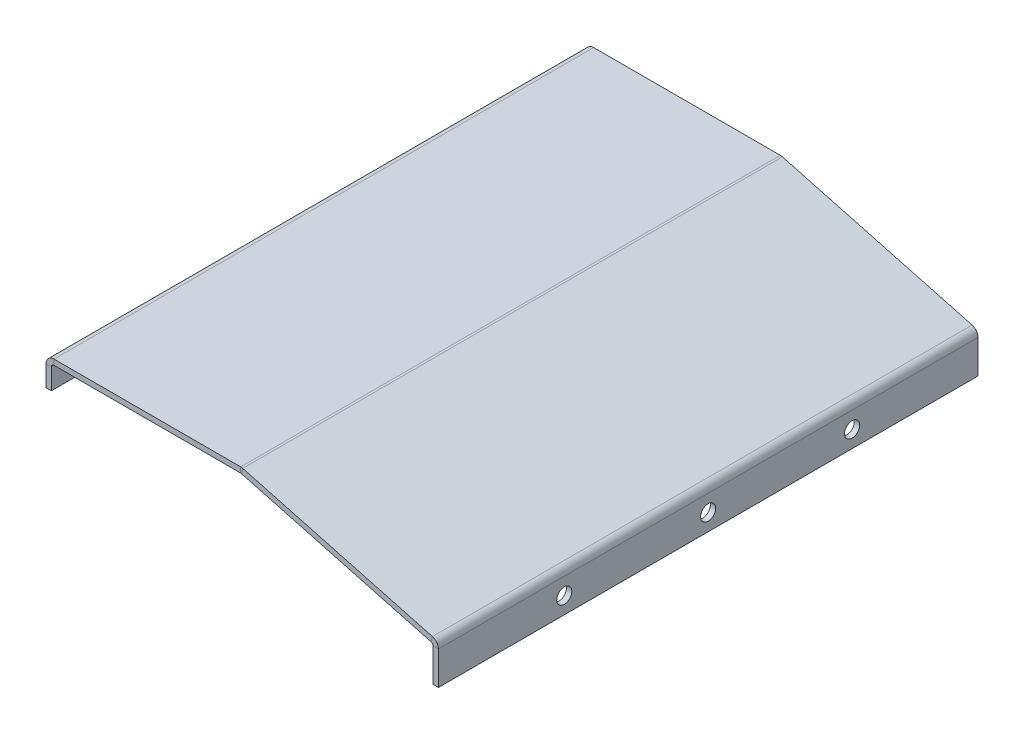
from build123d import *

# Parameters (mm, degrees)
SKETCH_1_W                       = 60
SKETCH_1_H                       = 1.5
SM_BASE_FLANGE_1_DEPTH           = 150
SM_EDGE_FLANGE_1_DEPTH           = 150
SM_EDGE_FLANGE_1_2_DEPTH         = 150
SM_EDGE_FLANGE_2_STRIP_W         = 7.4732
SM_EDGE_FLANGE_2_STRIP_H         = 1.5
SM_EDGE_FLANGE_2_STRIP_CUT_DEPTH = 150
SM_EDGE_FLANGE_2_DEPTH           = 150
SKETCH_12_R                      = 2.1
CUT_EXTRUDE_1_DEPTH              = 10
SM_EDGE_FLANGE_3_DEPTH           = 150
SM_EDGE_FLANGE_3_2_DEPTH         = 150
SKETCH_16_R                      = 2.1
CUT_EXTRUDE_2_DEPTH              = 20


# Read off the part's stored shape, not the designer's step: 边线-法兰1, 边线-法兰3
# Sheet-metal steps are written as plain solids
with BuildPart() as part:
    # Sketch 1 → 基体-法兰1 (new body)
    with BuildSketch(Plane.XY):
        with Locations((30, -0.75)):
            Rectangle(SKETCH_1_W, SKETCH_1_H)
    extrude(amount=SM_BASE_FLANGE_1_DEPTH)

    # 边线-法兰1 outline → 边线-法兰1 (cut)
    with BuildSketch(Plane.XY):
        with BuildLine():
            ThreePointArc((54.107469813, 0), (54.399404694, -0.019134423), (54.686344489, -0.076210297))
            Line((54.686344489, -0.076210297), (60, -1.5))
            Line((60, -1.5), (60, 0))
            Line((60, 0), (54.107469813, 0))
        make_face()
    extrude(amount=SM_EDGE_FLANGE_1_DEPTH, mode=Mode.SUBTRACT)

    # Sm Edge Flange 1 2 outline → Sm Edge Flange 1 2 (add)
    with BuildSketch(Plane.XY):
        with BuildLine():
            Line((109.459695887, -14.752685571), (60, -1.5))
            Line((60, -1.5), (54.107469813, -1.5))
            ThreePointArc((54.107469813, -1.5), (54.203615406, -1.506301715), (54.298115921, -1.525099036))
            Line((54.298115921, -1.525099036), (109.071467319, -16.20157431))
            Line((109.071467319, -16.20157431), (109.459695887, -14.752685571))
        make_face()
    extrude(amount=SM_EDGE_FLANGE_1_2_DEPTH)

    # 边线-法兰2 strip (across the edge) → 边线-法兰2 strip cut (cut)
    with BuildSketch(Plane(origin=(0, -1.5, 150), x_dir=(1, 0, 0), z_dir=(0, 0, -1))):
        with Locations((-1.5, -0.75)):
            Rectangle(SM_EDGE_FLANGE_2_STRIP_W, SM_EDGE_FLANGE_2_STRIP_H)
    extrude(amount=SM_EDGE_FLANGE_2_STRIP_CUT_DEPTH, mode=Mode.SUBTRACT)

    # 边线-法兰2 section (across the edge) → 边线-法兰2 (add)
    with BuildSketch(Plane(origin=(0, -1.5, 150), x_dir=(1, 0, 0), z_dir=(0, 0, -1))):
        with BuildLine():
            Line((0, 0.7366), (0, 6.5))
            Line((0, 6.5), (1.5, 6.5))
            Line((1.5, 6.5), (1.5, 0.7366))
            ThreePointArc((1.5, 0.7366), (1.715745145, 0.215745145), (2.2366, 0))
            Line((2.2366, 0), (2.2366, -1.5))
            ThreePointArc((2.2366, -1.5), (0.655084973, -0.844915027), (0, 0.7366))
        make_face()
    extrude(amount=SM_EDGE_FLANGE_2_DEPTH)

    # 草图12 → 切除-拉伸1 (cut)
    with BuildSketch(Plane.ZY):
        with Locations(Location((35, -5, 0), (0, 0, 270))):
            Circle(SKETCH_12_R)
        with Locations(Location((75, -5, 0), (0, 0, 270))):
            Circle(SKETCH_12_R)
        with Locations(Location((115, -5, 0), (0, 0, 270))):
            Circle(SKETCH_12_R)
    extrude(amount=-CUT_EXTRUDE_1_DEPTH, mode=Mode.SUBTRACT)

    # 边线-法兰3 outline → 边线-法兰3 (cut)
    with BuildSketch(Plane.XY):
        with BuildLine():
            ThreePointArc((107.413741996, -14.204473878), (108.55784048, -14.938769949), (109.065378631, -16.199942851))
            Line((109.065378631, -16.199942851), (109.071467319, -16.20157431))
            Line((109.071467319, -16.20157431), (109.459695887, -14.752685571))
            Line((109.459695887, -14.752685571), (107.413741996, -14.204473878))
        make_face()
    extrude(amount=SM_EDGE_FLANGE_3_DEPTH, mode=Mode.SUBTRACT)

    # Sm Edge Flange 3 2 outline → Sm Edge Flange 3 2 (add)
    with BuildSketch(Plane.XY):
        with BuildLine():
            Line((109.071467319, -25.64866004), (109.071467319, -16.364863581))
            ThreePointArc((109.071467319, -16.364863581), (109.069944629, -16.282347038), (109.065378631, -16.199942851))
            Line((109.065378631, -16.199942851), (107.025513428, -15.653362617))
            ThreePointArc((107.025513428, -15.653362617), (107.41925139, -15.916449912), (107.571467319, -16.364863581))
            Line((107.571467319, -16.364863581), (107.571467319, -25.64866004))
            Line((107.571467319, -25.64866004), (109.071467319, -25.64866004))
        make_face()
    extrude(amount=SM_EDGE_FLANGE_3_2_DEPTH)

    # 草图16 → 切除-拉伸2 (cut)
    with BuildSketch(Plane.ZY.offset(-107.571467319)):
        with Locations(Location((35, -21.00676181, 0), (0, 0, 270))):
            Circle(SKETCH_16_R)
        with Locations(Location((75, -21.00676181, 0), (0, 0, 270))):
            Circle(SKETCH_16_R)
        with Locations(Location((115, -21.00676181, 0), (0, 0, 90))):
            Circle(SKETCH_16_R)
    extrude(amount=-CUT_EXTRUDE_2_DEPTH, mode=Mode.SUBTRACT)


solid = part.part
